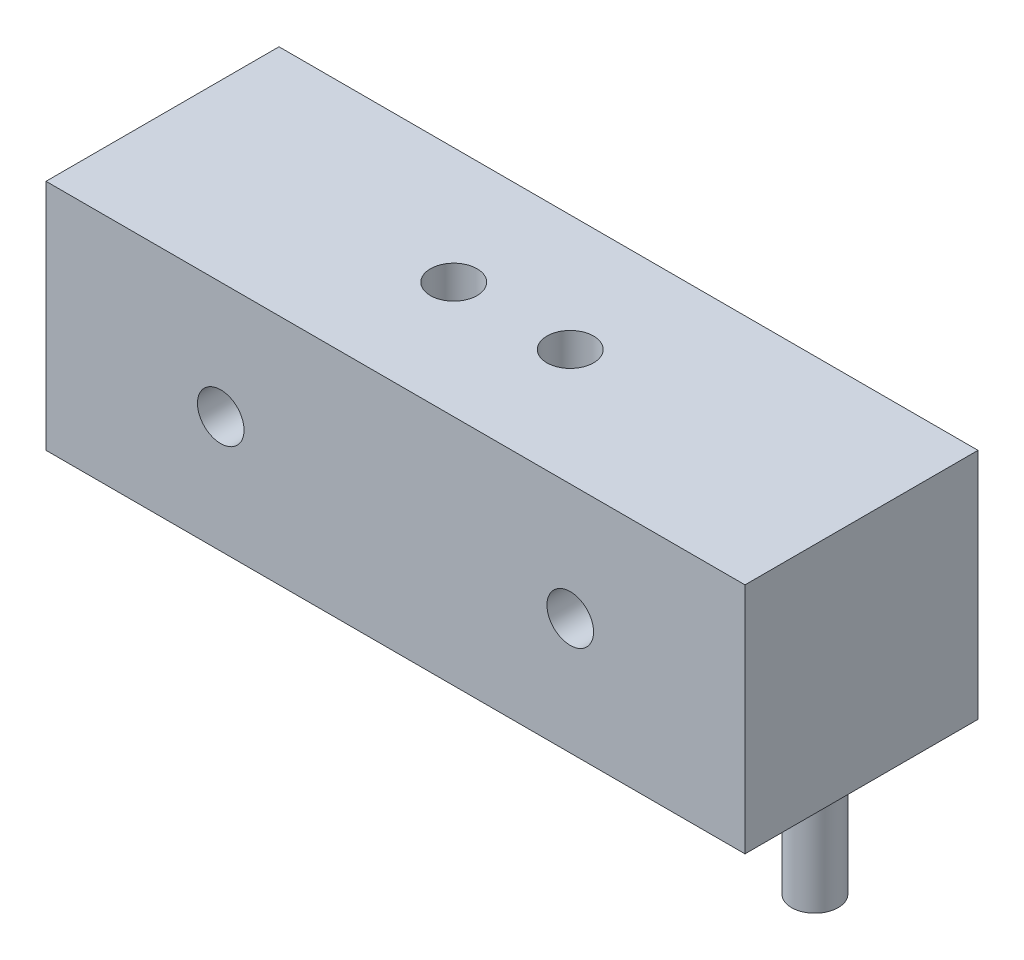
from build123d import *

# Parameters (mm, degrees)
SKETCH1_W           = 30
SKETCH1_H           = 10
BOSS_EXTRUDE1_DEPTH = 10
SKETCH2_R           = 1
CUT_EXTRUDE1_DEPTH  = 19.708286934
SKETCH4_R           = 1
CUT_EXTRUDE3_DEPTH  = 21.615528128
SKETCH3_R           = 1
BOSS_EXTRUDE2_DEPTH = 5


with BuildPart() as part:
    # Sketch1 → Boss-Extrude1 (new body)
    with BuildSketch(Plane.XY):
        Rectangle(SKETCH1_W, SKETCH1_H)
    extrude(amount=BOSS_EXTRUDE1_DEPTH)

    # Sketch2 → Cut-Extrude1 (cut, through all)
    with BuildSketch(Plane.XY.offset(10)):
        with Locations((-7.5, 0)):
            Circle(SKETCH2_R)
        with Locations((7.5, 0)):
            Circle(SKETCH2_R)
    extrude(amount=-CUT_EXTRUDE1_DEPTH, mode=Mode.SUBTRACT)

    # Sketch4 → Cut-Extrude3 (cut, through all)
    with BuildSketch(Plane(origin=(0, 5, 0), x_dir=(1, 0, 0), z_dir=(0, 1, 0))):
        with Locations((-2.5, -5)):
            Circle(SKETCH4_R)
        with Locations((2.5, -5)):
            Circle(SKETCH4_R)
    extrude(amount=-CUT_EXTRUDE3_DEPTH, mode=Mode.SUBTRACT)

    # Sketch3 → Boss-Extrude2 (add)
    with BuildSketch(Plane.XZ.offset(5)):
        with Locations((13, 5)):
            Circle(SKETCH3_R)
    extrude(amount=BOSS_EXTRUDE2_DEPTH)


solid = part.part
